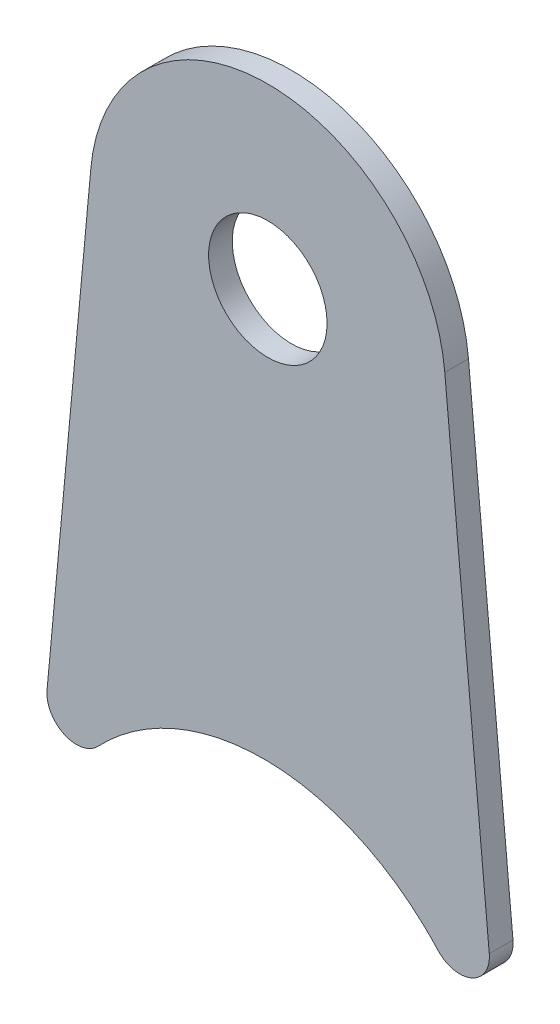
from build123d import *

# Parameters (mm, degrees)
SKETCH1_R           = 3.175
BOSS_EXTRUDE1_DEPTH = 0.635
SKETCH3_R           = 12.7
CUT_EXTRUDE1_DEPTH  = 239.777071188
CUT_EXTRUDE2_DEPTH  = 2.54


with BuildPart() as part:
    # Sketch1 → Boss-Extrude1 (new, symmetric)
    with BuildSketch(Plane.XY):
        with BuildLine():
            Line((-9.484545184, 0.876942223), (-12.115371852, -27.576693328))
            Line((-12.115371852, -27.576693328), (12.115371852, -27.576693328))
            Line((12.115371852, -27.576693328), (9.484545184, 0.876942223))
            ThreePointArc((9.484545184, 0.876942223), (0, 9.525), (-9.484545184, 0.876942223))
        make_face()
        Circle(SKETCH1_R, mode=Mode.SUBTRACT)
    extrude(amount=BOSS_EXTRUDE1_DEPTH, both=True)

    # Sketch3 → Cut-Extrude1 (cut, through all)
    with BuildSketch(Plane(origin=(-10.234654006, 38.091107641, -227.844114987), x_dir=(-0.9990889360534101, -0.013334766916774946, 0.04053987971048249), z_dir=(-0.04267601884298755, 0.30693794962268295, -0.9507722400749491))):
        Circle(SKETCH3_R)
    extrude(amount=-CUT_EXTRUDE1_DEPTH, mode=Mode.SUBTRACT)

    # Sketch4 → Cut-Extrude2 (cut)
    with BuildSketch(Plane(origin=(0, 0, -0.635), x_dir=(-1, 0, 0), z_dir=(0, 0, -1))):
        with BuildLine():
            Line((-12.115371852, -27.576693328), (12.115371852, -27.576693328))
            Line((12.115371852, -27.576693328), (11.834023856, -24.533781602))
            ThreePointArc((11.834023856, -24.533781602), (10.909017726, -26.125672484), (9.101988814, -25.772969444))
            add(Edge.make_bspline(
                [(9.101988814, -25.772969444), (-0.049020897, -16.134309997), (-9.112527933, -26.125826157)],
                knots=[5.634452132, 5.634452132, 5.634452132, 7.231690845, 7.231690845, 7.231690845], degree=2, weights=[1, 0.697696458, 1]))
            ThreePointArc((-9.112527933, -26.125826157), (-10.927624329, -26.512315749), (-11.869092937, -24.913070304))
            Line((-11.869092937, -24.913070304), (-12.115371852, -27.576693328))
        make_face()
    extrude(amount=-CUT_EXTRUDE2_DEPTH, mode=Mode.SUBTRACT)


solid = part.part
